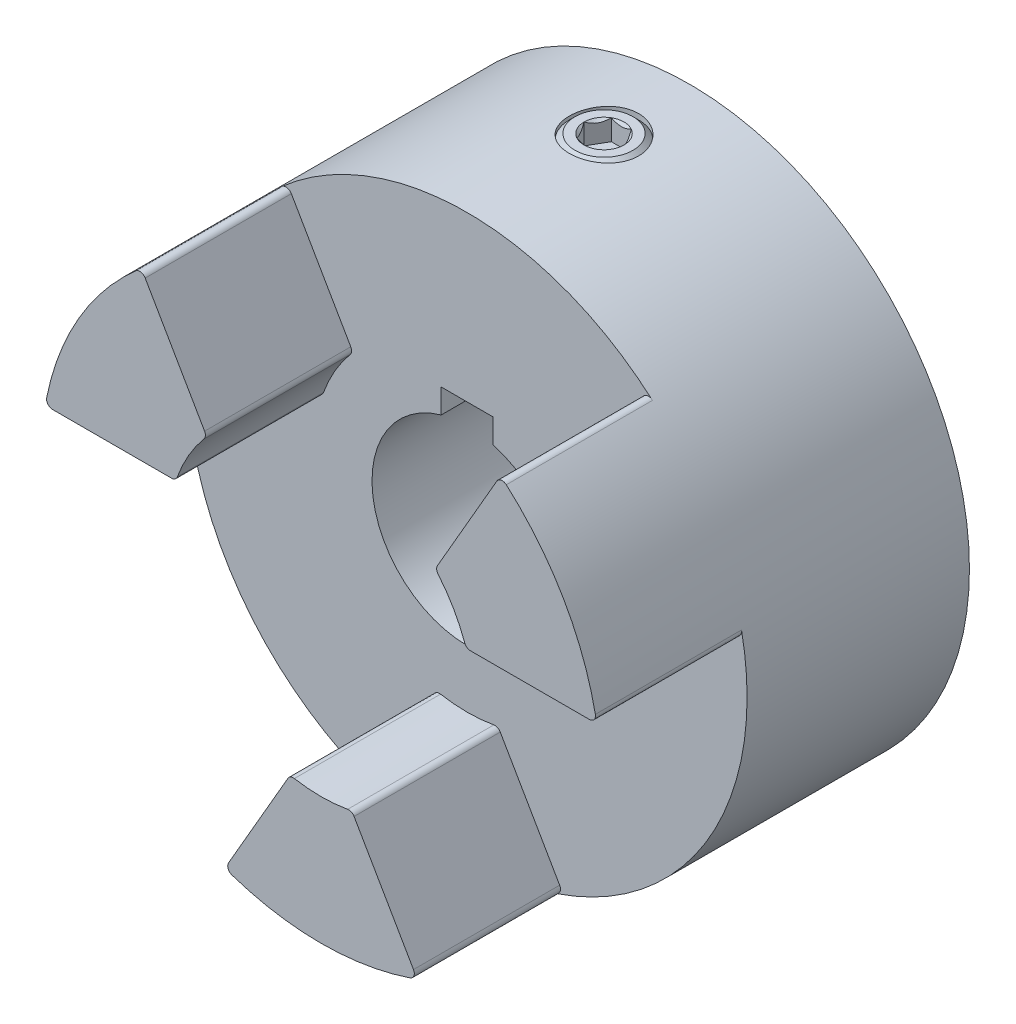
from build123d import *
from OCP.BRepFilletAPI import BRepFilletAPI_MakeChamfer

# Parameters (mm, degrees)
BOSS_EXTRUDE1_START      = -9.128125
SKETCH1_R                = 32.3453125
BOSS_EXTRUDE1_DEPTH      = 26.9875
BOSS_EXTRUDE2_DEPTH      = 16.891
FILLET1_R                = 0.713235825
CIRPATTERN1_COUNT        = 3
FILLET1_OF_CIRPATTERN1_R = 0.713235825
CUT_EXTRUDE5_DEPTH       = 59.281874117
CUT_EXTRUDE5_DEPTH_BACK  = 59.281874117
SKETCH15_R               = 11
CHAMFER1_SIZE            = 1.2938125
CHAMFER1_SIZE2           = 1.918155913
CUT_EXTRUDE1_DEPTH       = 59.281874117
CUT_EXTRUDE1_DEPTH_BACK  = 59.281874117
SKETCH5_R                = 4
CUT_EXTRUDE2_DEPTH       = 59.281874117
SKETCH6_R                = 4
BOSS_EXTRUDE3_DEPTH      = 12
CUT_EXTRUDE3_DEPTH       = 2.4
CHAMFER3_SIZE            = 0.64
CHAMFER4_SIZE            = 1.36


with BuildPart() as part:
    # Sketch1 → Boss-Extrude1 (new body)
    with BuildSketch(Plane.XY.offset(BOSS_EXTRUDE1_START)):
        Circle(SKETCH1_R)
    extrude(amount=-BOSS_EXTRUDE1_DEPTH)

    # Sketch2 → Boss-Extrude2 (add)
    with BuildSketch(Plane.XY.offset(-9.128125)):
        with BuildLine():
            Line((-11.114350717, -30.375820135), (-3.566179127, -17.302003437))
            ThreePointArc((-3.566179127, -17.302003437), (0, -17.6657), (3.566179127, -17.302003437))
            Line((3.566179127, -17.302003437), (11.114350717, -30.375820135))
            ThreePointArc((11.114350717, -30.375820135), (0, -32.3453125), (-11.114350717, -30.375820135))
        make_face()
    boss_extrude2 = extrude(amount=BOSS_EXTRUDE2_DEPTH)

    # Fillet1
    # the kernel refuses this fillet: 0.713235825 mm, written as the material it takes off along each edge
    with BuildSketch(Plane(origin=(-11.114350717, -30.375820135, -9.128125), x_dir=(0.9436455754007305, -0.3309577435664929, 0), z_dir=(0, 0, 1))) as fillet1_piece_1:
        with BuildLine():
            CenterArc((0.860200247, 0.713171354), FILLET1_R, 169.326916929, 101.443469756)
            Line((0.159303464, 0.845266176), (0, 0))
            ThreePointArc((0, 0), (0.434894987, -0.002923796), (0.869789973, 0))
        make_face()
    extrude(amount=19.065474933, mode=Mode.SUBTRACT)
    with BuildSketch(Plane(origin=(11.114350717, -30.375820135, -9.128125), x_dir=(-0.9436455754007282, -0.3309577435664989, 0), z_dir=(0, 0, 1))) as fillet1_piece_2:
        with BuildLine():
            CenterArc((0.860200247, -0.713171354), FILLET1_R, 89.229613314, 101.443469756)
            Line((0.159303464, -0.845266176), (0, 0))
            ThreePointArc((0, 0), (0.434894987, 0.002923796), (0.869789973, 0))
        make_face()
    extrude(amount=19.065474933, mode=Mode.SUBTRACT)
    with BuildSketch(Plane(origin=(3.566179127, -17.302003437, -9.128125), x_dir=(0.500000000000002, -0.8660254037844376, 0), z_dir=(0, 0, 1))) as fillet1_piece_3:
        with BuildLine():
            CenterArc((0.507170112, -0.713235825), FILLET1_R, 90, 70.033604576)
            ThreePointArc((-0.163195289, -0.469687941), (-0.07994504, -0.235418176), (0, 0))
            Line((0, 0), (0.507170112, 0))
        make_face()
    extrude(amount=18.158925279, mode=Mode.SUBTRACT)
    with BuildSketch(Plane(origin=(-3.566179127, -17.302003437, -9.128125), x_dir=(0.9821562739684868, -0.18806661985673784, 0), z_dir=(0, 0, 1))) as fillet1_piece_4:
        with BuildLine():
            CenterArc((0.507269431, -0.71316519), FILLET1_R, 90.806371221, 70.033604577)
            Line((-0.166457119, -0.479075724), (0, 0))
            ThreePointArc((0, 0), (0.248615901, -0.001749518), (0.497231801, 0))
        make_face()
    extrude(amount=18.158925279, mode=Mode.SUBTRACT)

    # CirPattern1: Boss-Extrude2 ×3 about axis
    cirpattern1_axis = Axis((0, 0, 0), (0, 0, 1))
    for i in range(1, CIRPATTERN1_COUNT):
        add(boss_extrude2.rotate(cirpattern1_axis, i * 360 / CIRPATTERN1_COUNT))

    # Fillet1 of CirPattern1
    # the kernel refuses this fillet: 0.713235825 mm, written as the material it takes off along each edge
    with BuildSketch(Plane(origin=(31.863407256, 5.5626, -9.128125), x_dir=(-0.18520497419260348, 0.9826999122490635, 0), z_dir=(0, 0, 1)), Plane(origin=(-20.749056539, 24.813220135, -9.128125), x_dir=(-0.7584406012081224, -0.6517421686825718, 0), z_dir=(0, 0, 1))) as fillet1_of_cirpattern1_piece_1:
        with BuildLine():
            CenterArc((0.860200247, 0.713171354), FILLET1_OF_CIRPATTERN1_R, 169.326916929, 101.443469756)
            Line((0.159303464, 0.845266176), (0, 0))
            ThreePointArc((0, 0), (0.434894987, -0.002923796), (0.869789973, 0))
        make_face()
    extrude(amount=19.065474933, mode=Mode.SUBTRACT)
    with BuildSketch(Plane(origin=(20.749056539, 24.813220135, -9.128125), x_dir=(0.7584406012081266, -0.6517421686825667, 0), z_dir=(0, 0, 1)), Plane(origin=(-31.863407256, 5.5626, -9.128125), x_dir=(0.18520497419260348, 0.9826999122490635, 0), z_dir=(0, 0, 1))) as fillet1_of_cirpattern1_piece_2:
        with BuildLine():
            CenterArc((0.860200247, -0.713171354), FILLET1_OF_CIRPATTERN1_R, 89.229613314, 101.443469756)
            Line((0.159303464, -0.845266176), (0, 0))
            ThreePointArc((0, 0), (0.434894987, 0.002923796), (0.869789973, 0))
        make_face()
    extrude(amount=19.065474933, mode=Mode.SUBTRACT)
    with BuildSketch(Plane(origin=(13.200884949, 11.739403437, -9.128125), x_dir=(0.49999999999999967, 0.8660254037844388, 0), z_dir=(0, 0, 1)), Plane(origin=(-16.767064076, 5.5626, -9.128125), x_dir=(-1, 0, 0), z_dir=(0, 0, 1))) as fillet1_of_cirpattern1_piece_3:
        with BuildLine():
            CenterArc((0.507170112, -0.713235825), FILLET1_OF_CIRPATTERN1_R, 90, 70.033604576)
            ThreePointArc((-0.163195289, -0.469687941), (-0.07994504, -0.235418176), (0, 0))
            Line((0, 0), (0.507170112, 0))
        make_face()
    extrude(amount=18.158925279, mode=Mode.SUBTRACT)
    with BuildSketch(Plane(origin=(16.767064076, 5.5626, -9.128125), x_dir=(-0.3282076665844337, 0.9446055936713488, 0), z_dir=(0, 0, 1)), Plane(origin=(-13.200884949, 11.739403437, -9.128125), x_dir=(-0.6539486073840537, -0.7565389738146059, 0), z_dir=(0, 0, 1))) as fillet1_of_cirpattern1_piece_4:
        with BuildLine():
            CenterArc((0.507269431, -0.71316519), FILLET1_OF_CIRPATTERN1_R, 90.806371221, 70.033604577)
            Line((-0.166457119, -0.479075724), (0, 0))
            ThreePointArc((0, 0), (0.248615901, -0.001749518), (0.497231801, 0))
        make_face()
    extrude(amount=18.158925279, mode=Mode.SUBTRACT)

    # Sketch15 → Cut-Extrude5 (cut, two sides: drawn at the far end of the back side and taken through both)
    with BuildSketch(Plane.XY.offset(-CUT_EXTRUDE5_DEPTH_BACK)):
        Circle(SKETCH15_R)
    extrude(amount=CUT_EXTRUDE5_DEPTH + CUT_EXTRUDE5_DEPTH_BACK, mode=Mode.SUBTRACT)

    # Chamfer1: one chamfer whose edges measure the first distance from different faces: ONE call of the kernel's chamfer builder (chamfer() names one face for all edges)
    chamfer1_edges_1 = [part.edges().sort_by_distance(p)[0] for p in [
        (-32.3453125, 0, -36.115625),
    ]]
    chamfer1_side_1 = [part.faces().sort_by_distance(p)[0] for p in [
        (-32.3453125, 0, -22.621875),
    ]]
    chamfer1_edges_2 = [part.edges().sort_by_distance(p)[0] for p in [
        (-11, 0, -36.115625),
    ]]
    chamfer1_side_2 = [part.faces().sort_by_distance(p)[0] for p in [
        (-11, 0, -22.621875),
    ]]
    chamfer1 = BRepFilletAPI_MakeChamfer(part.part.solid().wrapped)
    for e in chamfer1_edges_1:
        chamfer1.Add(CHAMFER1_SIZE, CHAMFER1_SIZE2, e.wrapped, chamfer1_side_1[0].wrapped)  # the first distance lies on this face
    for e in chamfer1_edges_2:
        chamfer1.Add(CHAMFER1_SIZE, CHAMFER1_SIZE2, e.wrapped, chamfer1_side_2[0].wrapped)  # the first distance lies on this face
    add(Compound.cast(chamfer1.Shape()), mode=Mode.REPLACE)

    # Sketch4 → Cut-Extrude1 (cut, two sides: drawn at the far end of the back side and taken through both)
    with BuildSketch(Plane.XY.offset(-CUT_EXTRUDE1_DEPTH_BACK)):
        with BuildLine():
            Line((-3, 13.383005244), (3, 13.383005244))
            Line((3, 13.383005244), (3, 10.583005244))
            ThreePointArc((3, 10.583005244), (0, 11), (-3, 10.583005244))
            Line((-3, 10.583005244), (-3, 13.383005244))
        make_face()
    extrude(amount=CUT_EXTRUDE1_DEPTH + CUT_EXTRUDE1_DEPTH_BACK, mode=Mode.SUBTRACT)

    # Sketch5 → Cut-Extrude2 (cut, through all)
    with BuildSketch(Plane(origin=(0, 0, 0), x_dir=(1, 0, 0), z_dir=(0, 1, 0))):
        with Locations(Location((0, 24.939625, 0), (0, 0, 90))):
            Circle(SKETCH5_R)
    extrude(amount=CUT_EXTRUDE2_DEPTH, mode=Mode.SUBTRACT)


with BuildPart() as body_2:
    # Sketch6 → Boss-Extrude3 (new body)
    with BuildSketch(Plane(origin=(0, 32.3453125, 0), x_dir=(-1, 0, 0), z_dir=(0, 1, 0))):
        with Locations(Location((0, -24.939625, 0), (0, 0, 90))):
            Circle(SKETCH6_R)
    extrude(amount=-BOSS_EXTRUDE3_DEPTH)

    # Sketch8 → Cut-Extrude3 (cut)
    with BuildSketch(Plane(origin=(0, 32.3453125, 0), x_dir=(1, 0, 0), z_dir=(0, 1, 0))):
        Polygon((1.154700538, 22.939625), (2.309401077, 24.939625), (1.154700538, 26.939625), (-1.154700538, 26.939625), (-2.309401077, 24.939625), (-1.154700538, 22.939625), align=None)
    extrude(amount=-CUT_EXTRUDE3_DEPTH, mode=Mode.SUBTRACT)

    # Cut-Extrude4 cone 1 section (through the dimple's axis) → Cut-Extrude4 (revolve, cut)
    with BuildSketch(Plane(origin=(0, 32.3453125, -24.939625), x_dir=(0, 0, 1), z_dir=(1, 0, 0))):
        Polygon((0, 0), (2.309401077, 0), (0, 2.309401077), align=None)
    revolve(axis=Axis((0, 32.3453125, -24.939625), (0, -1, 0)), mode=Mode.SUBTRACT)

    # Chamfer3
    chamfer3_edges = [body_2.edges().sort_by_distance(p)[0] for p in [
        (0, 32.3453125, -28.939625),
    ]]
    chamfer(chamfer3_edges, length=CHAMFER3_SIZE)

    # Chamfer4
    chamfer4_edges = [body_2.edges().sort_by_distance(p)[0] for p in [
        (0, 20.3453125, -28.939625),
    ]]
    chamfer(chamfer4_edges, length=CHAMFER4_SIZE)


solid = Compound([part.part, body_2.part])
